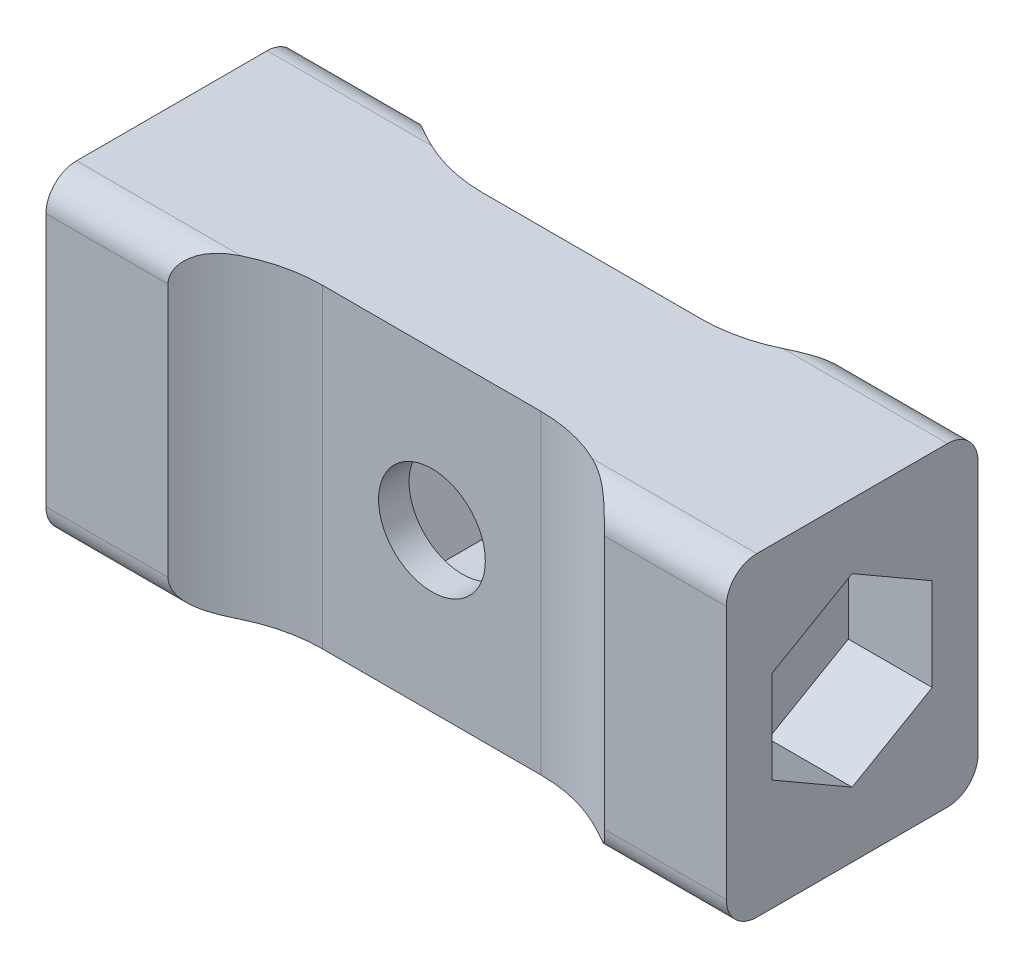
from build123d import *

# Parameters (mm, degrees)
CROQUIS1_W              = 44.6
CROQUIS1_H              = 20.647373716
SALIENTE_EXTRUIR2_DEPTH = 10.5
CROQUIS2_R              = 7.366343287
CROQUIS2_R_2            = 3.5
SALIENTE_EXTRUIR3_DEPTH = 2
SALIENTE_EXTRUIR4_START = -2
CROQUIS3_R              = 6.292932571
CROQUIS3_R_2            = 3.5
SALIENTE_EXTRUIR4_DEPTH = 2
CORTAR_EXTRUIR1_DEPTH   = 5.5
CORTAR_EXTRUIR2_DEPTH   = 5.5
CROQUIS6_W              = 8
CROQUIS6_H              = 20.647373716
SALIENTE_EXTRUIR5_DEPTH = 3
CROQUIS7_W              = 8
CROQUIS7_H              = 20.647373716
SALIENTE_EXTRUIR6_DEPTH = 3
REDONDEO1_R             = 10
REDONDEO2_R             = 2


with BuildPart() as part:
    # Croquis1 → Saliente-Extruir2 (new body)
    with BuildSketch(Plane.XY):
        Rectangle(CROQUIS1_W, CROQUIS1_H)
        Polygon((5.946707773, 0), (2.973353886, 5.15), (-2.973353886, 5.15), (-5.946707773, 0), (-2.973353886, -5.15), (2.973353886, -5.15), align=None, mode=Mode.SUBTRACT)
    extrude(amount=SALIENTE_EXTRUIR2_DEPTH)

    # Croquis2 → Saliente-Extruir3 (add)
    with BuildSketch(Plane.XY.offset(10.5)):
        Circle(CROQUIS2_R)
        Circle(CROQUIS2_R_2, mode=Mode.SUBTRACT)
    extrude(amount=-SALIENTE_EXTRUIR3_DEPTH)

    # Croquis3 → Saliente-Extruir4 (add)
    with BuildSketch(Plane(origin=(0, 0, 0), x_dir=(-1, 0, 0), z_dir=(0, 0, -1)).offset(SALIENTE_EXTRUIR4_START)):
        Circle(CROQUIS3_R)
        with Locations(Location((0, 0, 0), (0, 0, 180))):
            Circle(CROQUIS3_R_2, mode=Mode.SUBTRACT)
    extrude(amount=SALIENTE_EXTRUIR4_DEPTH)

    # Croquis4 → Cortar-Extruir1 (cut)
    with BuildSketch(Plane(origin=(22.3, 0, 0), x_dir=(0, 0, -1), z_dir=(1, 0, 0))):
        Polygon((-5.25, 6.062177826), (-10.5, 3.031088913), (-10.5, -3.031088913), (-5.25, -6.062177826), (0, -3.031088913), (0, 3.031088913), align=None)
    extrude(amount=-CORTAR_EXTRUIR1_DEPTH, mode=Mode.SUBTRACT)

    # Croquis5 → Cortar-Extruir2 (cut)
    with BuildSketch(Plane.ZY.offset(22.3)):
        Polygon((5.25, 6.062177826), (0, 3.031088913), (0, -3.031088913), (5.25, -6.062177826), (10.5, -3.031088913), (10.5, 3.031088913), align=None)
    extrude(amount=-CORTAR_EXTRUIR2_DEPTH, mode=Mode.SUBTRACT)

    # Croquis6 → Saliente-Extruir5 (add)
    with BuildSketch(Plane(origin=(0, 0, 0), x_dir=(-1, 0, 0), z_dir=(0, 0, -1))):
        with Locations((-18.3, 0)):
            Rectangle(CROQUIS6_W, CROQUIS6_H)
        with Locations((18.3, 0)):
            Rectangle(CROQUIS6_W, CROQUIS6_H)
    extrude(amount=SALIENTE_EXTRUIR5_DEPTH)

    # Croquis7 → Saliente-Extruir6 (add)
    with BuildSketch(Plane.XY.offset(10.5)):
        with Locations((-18.3, 0)):
            Rectangle(CROQUIS7_W, CROQUIS7_H)
        with Locations((18.3, 0)):
            Rectangle(CROQUIS7_W, CROQUIS7_H)
    extrude(amount=SALIENTE_EXTRUIR6_DEPTH)

    # Redondeo1
    # the kernel refuses this fillet: 10 mm, written as the material it adds along each edge
    with BuildSketch(Plane(origin=(-14.3, 10.323686858, 10.5), x_dir=(1, 0, 0), z_dir=(0, -1, 0)), Plane(origin=(14.3, 10.323686858, 0), x_dir=(-1, 0, 0), z_dir=(0, -1, 0))) as redondeo1_piece_1:
        with BuildLine():
            CenterArc((7.141428429, 10), REDONDEO1_R, 224.427004001, 45.572995999)
            Line((0, 3), (-0.142828569, 2.86))
            ThreePointArc((-0.142828569, 2.86), (-0.2, 1.5), (-0.2, 0))
            Line((-0.2, 0), (0, -0.2))
            Line((0, -0.2), (7.141428429, -0.2))
            Line((7.141428429, -0.2), (7.141428429, 0))
        make_face()
    extrude(amount=20.647373716)
    with BuildSketch(Plane(origin=(14.3, 10.323686858, 10.5), x_dir=(0, 0, 1), z_dir=(0, -1, 0)), Plane(origin=(-14.3, 10.323686858, 0), x_dir=(0, 0, -1), z_dir=(0, -1, 0))) as redondeo1_piece_2:
        with BuildLine():
            CenterArc((10, 7.141428429), REDONDEO1_R, 180, 45.572995999)
            Line((0, 7.141428429), (-0.2, 7.141428429))
            Line((-0.2, 7.141428429), (-0.2, 0))
            Line((-0.2, 0), (0, -0.2))
            ThreePointArc((0, -0.2), (1.5, -0.2), (2.86, -0.142828569))
            Line((2.86, -0.142828569), (3, 0))
        make_face()
    extrude(amount=20.647373716)

    # Redondeo2
    redondeo2_edges = [part.edges().sort_by_distance(p)[0] for p in [
        (18.3, -10.323686858, -3),
        (18.3, 10.323686858, -3),
        (-18.3, 10.323686858, -3),
        (-18.3, -10.323686858, 13.5),
        (-18.3, 10.323686858, 13.5),
        (18.3, 10.323686858, 13.5),
        (18.3, -10.323686858, 13.5),
    ]]
    fillet(redondeo2_edges, radius=REDONDEO2_R)


solid = part.part
